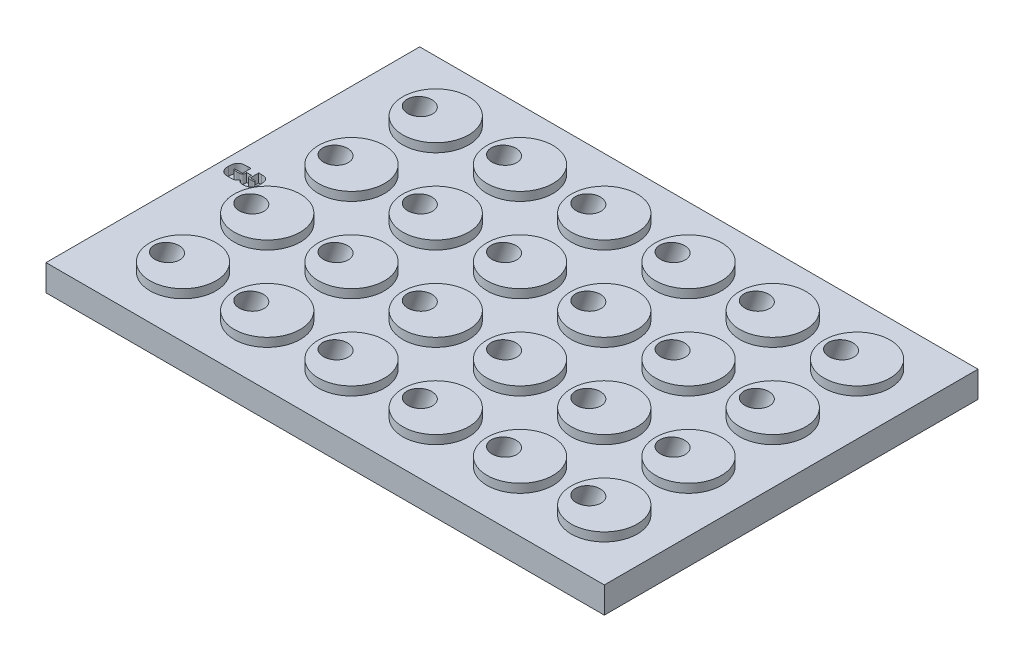
from build123d import *

# Parameters (mm, degrees)
SKETCH1_W           = 127.89
SKETCH1_H           = 85.6
MAIN_PLATE_DEPTH    = 6
WELLS_LSP_R         = 7.56
BOSS_EXTRUDE1_DEPTH = 2
LPATTERN1_START     = -19.125363412
LPATTERN1_OUTLINE_R = 2.75
LPATTERN1_DEPTH     = 43.520202499
CUT_EXTRUDE1_DEPTH  = 2


# Read off the part's stored shape, not the designer's step: LPattern1
with BuildPart() as part:
    # Sketch1 → Main Plate (new body)
    with BuildSketch(Plane(origin=(0, 0, 0), x_dir=(1, 0, 0), z_dir=(0, 1, 0))):
        Rectangle(SKETCH1_W, SKETCH1_H)
    extrude(amount=MAIN_PLATE_DEPTH)

    # Wells_LSP → Boss-Extrude1 (add)
    with BuildSketch(Plane(origin=(0, 6, 0), x_dir=(1, 0, 0), z_dir=(0, 1, 0))):
        with Locations(Location((-46.425, 28.96, 0), (0, 0, 270))):
            Circle(WELLS_LSP_R)
        with Locations(Location((-27.125, 28.96, 0), (0, 0, 270))):
            Circle(WELLS_LSP_R)
        with Locations(Location((-7.825, 28.96, 0), (0, 0, 270))):
            Circle(WELLS_LSP_R)
        with Locations(Location((11.475, 28.96, 0), (0, 0, 270))):
            Circle(WELLS_LSP_R)
        with Locations(Location((30.775, 28.96, 0), (0, 0, 270))):
            Circle(WELLS_LSP_R)
        with Locations(Location((50.075, 28.96, 0), (0, 0, 270))):
            Circle(WELLS_LSP_R)
        with Locations(Location((-27.125, 9.66, 0), (0, 0, 270))):
            Circle(WELLS_LSP_R)
        with Locations(Location((-7.825, 9.66, 0), (0, 0, 270))):
            Circle(WELLS_LSP_R)
        with Locations(Location((11.475, 9.66, 0), (0, 0, 270))):
            Circle(WELLS_LSP_R)
        with Locations(Location((30.775, 9.66, 0), (0, 0, 270))):
            Circle(WELLS_LSP_R)
        with Locations(Location((50.075, 9.66, 0), (0, 0, 270))):
            Circle(WELLS_LSP_R)
        with Locations(Location((-27.125, -9.64, 0), (0, 0, 270))):
            Circle(WELLS_LSP_R)
        with Locations(Location((-7.825, -9.64, 0), (0, 0, 270))):
            Circle(WELLS_LSP_R)
        with Locations(Location((11.475, -9.64, 0), (0, 0, 270))):
            Circle(WELLS_LSP_R)
        with Locations(Location((30.775, -9.64, 0), (0, 0, 270))):
            Circle(WELLS_LSP_R)
        with Locations(Location((50.075, -9.64, 0), (0, 0, 270))):
            Circle(WELLS_LSP_R)
        with Locations(Location((-27.125, -28.94, 0), (0, 0, 270))):
            Circle(WELLS_LSP_R)
        with Locations(Location((-7.825, -28.94, 0), (0, 0, 270))):
            Circle(WELLS_LSP_R)
        with Locations(Location((11.475, -28.94, 0), (0, 0, 270))):
            Circle(WELLS_LSP_R)
        with Locations(Location((30.775, -28.94, 0), (0, 0, 270))):
            Circle(WELLS_LSP_R)
        with Locations(Location((50.075, -28.94, 0), (0, 0, 270))):
            Circle(WELLS_LSP_R)
        with Locations(Location((-46.425, 9.66, 0), (0, 0, 270))):
            Circle(WELLS_LSP_R)
        with Locations(Location((-46.425, -9.64, 0), (0, 0, 270))):
            Circle(WELLS_LSP_R)
        with Locations(Location((-46.425, -28.94, 0), (0, 0, 270))):
            Circle(WELLS_LSP_R)
    extrude(amount=BOSS_EXTRUDE1_DEPTH)

    # Sketch2 → Cut-Revolve1 (revolve, cut)
    with BuildSketch(Plane(origin=(0, 0, -28.96), x_dir=(-1, 0, 0), z_dir=(0, 0, -1)), mode=Mode.PRIVATE) as cut_revolve1_sk:
        Polygon((44.781366193, 22.559444606), (47.3655209, 23.5), (55.918821406, 0), (53.334666698, -0.940555394), align=None)
    revolve(cut_revolve1_sk.sketch.rotate(Axis((-44.781366193, 22.559444606, -28.96), (-0.3420201433256695, -0.9396926207859082, 0)), 180), axis=Axis((-44.781366193, 22.559444606, -28.96), (-0.3420201433256695, -0.9396926207859082, 0)), mode=Mode.SUBTRACT)

    # LPattern1 outline → LPattern1 (cut)
    with BuildSketch(Plane(origin=(0, 0, 0), x_dir=(0.9396926207859079, -0.34202014332566993, 0), z_dir=(0.34202014332567, 0.939692620785908, 0)).offset(LPATTERN1_START)):
        with Locations((-31.660436257, 28.96)):
            Circle(LPATTERN1_OUTLINE_R)
        with Locations((-13.524368676, 28.96)):
            Circle(LPATTERN1_OUTLINE_R)
        with Locations((4.611698906, 28.96)):
            Circle(LPATTERN1_OUTLINE_R)
        with Locations((22.747766487, 28.96)):
            Circle(LPATTERN1_OUTLINE_R)
        with Locations((40.883834068, 28.96)):
            Circle(LPATTERN1_OUTLINE_R)
        with Locations((-49.796503838, 9.66)):
            Circle(LPATTERN1_OUTLINE_R)
        with Locations((-31.660436257, 9.66)):
            Circle(LPATTERN1_OUTLINE_R)
        with Locations((-13.524368676, 9.66)):
            Circle(LPATTERN1_OUTLINE_R)
        with Locations((4.611698906, 9.66)):
            Circle(LPATTERN1_OUTLINE_R)
        with Locations((22.747766487, 9.66)):
            Circle(LPATTERN1_OUTLINE_R)
        with Locations((40.883834068, 9.66)):
            Circle(LPATTERN1_OUTLINE_R)
        with Locations((-49.796503838, -9.64)):
            Circle(LPATTERN1_OUTLINE_R)
        with Locations((-31.660436257, -9.64)):
            Circle(LPATTERN1_OUTLINE_R)
        with Locations((-13.524368676, -9.64)):
            Circle(LPATTERN1_OUTLINE_R)
        with Locations((4.611698906, -9.64)):
            Circle(LPATTERN1_OUTLINE_R)
        with Locations((22.747766487, -9.64)):
            Circle(LPATTERN1_OUTLINE_R)
        with Locations((40.883834068, -9.64)):
            Circle(LPATTERN1_OUTLINE_R)
        with Locations((-49.796503838, -28.94)):
            Circle(LPATTERN1_OUTLINE_R)
        with Locations((-31.660436257, -28.94)):
            Circle(LPATTERN1_OUTLINE_R)
        with Locations((-13.524368676, -28.94)):
            Circle(LPATTERN1_OUTLINE_R)
        with Locations((4.611698906, -28.94)):
            Circle(LPATTERN1_OUTLINE_R)
        with Locations((22.747766487, -28.94)):
            Circle(LPATTERN1_OUTLINE_R)
        with Locations((40.883834068, -28.94)):
            Circle(LPATTERN1_OUTLINE_R)
    extrude(amount=LPATTERN1_DEPTH, mode=Mode.SUBTRACT)

    # Sketch3 → Cut-Extrude1 (cut)
    with BuildSketch(Plane(origin=(0, 6, 0), x_dir=(1, 0, 0), z_dir=(0, 1, 0))):
        with BuildLine():
            add(Edge.make_bspline(
                [(-58.122258832, -4.102834302), (-58.140391436, -4.160972271), (-58.176105501, -4.275481094), (-58.26803878, -4.430861001), (-58.387557684, -4.565760961), (-58.508900564, -4.664784335), (-58.630694365, -4.728150883), (-58.746597581, -4.771454324), (-58.886825305, -4.805317995), (-59.050357082, -4.834405029), (-59.23764482, -4.856549617), (-59.448486266, -4.873065666), (-59.683548017, -4.881057935), (-59.848090402, -4.882803452), (-59.934577146, -4.88372093)],
                knots=[0, 0, 0, 0, 1.016772502, 2.00264, 2.993322914, 4.024041134, 4.601779415, 5.284513473, 6.090012932, 7.012903525, 8.063870125, 9.245484246, 10.552171844, 12, 12, 12, 12], degree=3))
            add(Edge.make_bspline(
                [(-59.934577146, -4.88372093), (-59.999874152, -4.883362561), (-60.126718514, -4.882666401), (-60.31168497, -4.87356146), (-60.485686156, -4.85874754), (-60.648987687, -4.836928912), (-60.801711646, -4.810188821), (-60.944481808, -4.779607974), (-61.075417297, -4.739614127), (-61.196790948, -4.694959633), (-61.309944933, -4.643234102), (-61.414654069, -4.579569657), (-61.51457145, -4.508691241), (-61.607626946, -4.426644089), (-61.694189965, -4.33521229), (-61.772972495, -4.23347996), (-61.847405325, -4.123971684), (-61.914393147, -4.00435865), (-61.974681603, -3.875818995), (-62.024400915, -3.737782073), (-62.070018712, -3.592654818), (-62.104725635, -3.438106385), (-62.13321013, -3.275618271), (-62.15100934, -3.104751355), (-62.165024753, -2.926222906), (-62.166060386, -2.804354881), (-62.166590228, -2.742005814)],
                knots=[0, 0, 0, 0, 1.306481367, 2.53793869, 3.70454975, 4.799899347, 5.83332077, 6.806790108, 7.719247424, 8.570123773, 9.393667299, 10.203998039, 11.018536018, 11.842079543, 12.682189451, 13.534080057, 14.414017936, 15.329427877, 16.27442779, 17.251402079, 18.26300703, 19.316565067, 20.418301405, 21.562113702, 22.752749651, 24, 24, 24, 24], degree=3))
            add(Edge.make_bspline(
                [(-62.166590228, -2.742005814), (-62.165404924, -2.674588433), (-62.163099281, -2.543448732), (-62.151278192, -2.352254117), (-62.127471672, -2.172465591), (-62.098217265, -2.002584656), (-62.057060121, -1.844381808), (-62.009399091, -1.69626143), (-61.950099258, -1.560346663), (-61.884880561, -1.433784645), (-61.809933311, -1.320300288), (-61.7342744, -1.214520279), (-61.651938062, -1.120676116), (-61.568014131, -1.034804757), (-61.477252138, -0.961713213), (-61.383639298, -0.89835106), (-61.286082203, -0.84392919), (-61.181597217, -0.799761157), (-61.065979111, -0.764124481), (-60.934939534, -0.734131583), (-60.786123697, -0.706989799), (-60.618625347, -0.688097575), (-60.433747585, -0.671556889), (-60.231078405, -0.658340277), (-60.010066692, -0.652978804), (-59.856574296, -0.651783467), (-59.776873658, -0.651162791)],
                knots=[0, 0, 0, 0, 1.29986345, 2.528483056, 3.690179472, 4.794698139, 5.849224155, 6.839060682, 7.790920779, 8.704834231, 9.579881091, 10.41028086, 11.209865728, 11.984243757, 12.722004226, 13.451891505, 14.161549165, 14.871959378, 15.634473006, 16.490848817, 17.462329798, 18.549016499, 19.73880478, 21.040824574, 22.463453722, 24, 24, 24, 24], degree=3))
            Line((-59.776873658, -0.651162791), (-59.154962321, -0.651162791))
            Line((-59.154962321, -0.651162791), (-59.154962321, -2.604651163))
            Line((-59.154962321, -2.604651163), (-60.344097495, -2.604651163))
            add(Edge.make_bspline(
                [(-60.344097495, -2.604651163), (-60.379287069, -2.604398856), (-60.445861937, -2.603921518), (-60.539538181, -2.607063491), (-60.621770559, -2.609769418), (-60.692662286, -2.611402962), (-60.752501162, -2.616471685), (-60.800745234, -2.623152505), (-60.837989188, -2.628543584), (-60.87074786, -2.638200344), (-60.898895575, -2.652347427), (-60.924723622, -2.668619633), (-60.94181248, -2.687647006), (-60.944471531, -2.702362056), (-60.945659995, -2.708938953)],
                knots=[0, 0, 0, 0, 1.98952573, 3.763967478, 5.298808493, 6.641994911, 7.772666489, 8.691384785, 9.396776596, 9.897288848, 10.615595082, 11.167430286, 11.62788259, 12, 12, 12, 12], degree=3))
            add(Edge.make_bspline(
                [(-60.945659995, -2.708938953), (-60.944217952, -2.728620253), (-60.941453407, -2.766351332), (-60.919547745, -2.81886366), (-60.879189917, -2.858480968), (-60.834859895, -2.884104707), (-60.785287141, -2.896122517), (-60.732394578, -2.906522915), (-60.662976714, -2.913155994), (-60.578188407, -2.919525296), (-60.477669325, -2.9242861), (-60.361936961, -2.928481221), (-60.230479417, -2.928825517), (-60.137640139, -2.929745345), (-60.088465228, -2.930232558)],
                knots=[0, 0, 0, 0, 0.731326549, 1.402028383, 2.059821905, 2.800938167, 3.275195982, 3.949224547, 4.805765994, 5.86494895, 7.111968563, 8.547350483, 10.171207919, 12, 12, 12, 12], degree=3))
            Line((-60.088465228, -2.930232558), (-59.619170169, -2.930232558))
            add(Edge.make_bspline(
                [(-59.619170169, -2.930232558), (-59.561921657, -2.92914035), (-59.456165609, -2.927122698), (-59.310503295, -2.915814377), (-59.191242355, -2.893952638), (-59.096019778, -2.862461226), (-59.021116543, -2.820078383), (-58.962011533, -2.768895794), (-58.915841211, -2.709050859), (-58.889513571, -2.650371313), (-58.875190563, -2.594349219), (-58.863341649, -2.539789532), (-58.855294445, -2.472075988), (-58.848162597, -2.392295098), (-58.839634014, -2.300398082), (-58.835858614, -2.19597023), (-58.829687613, -2.079032227), (-58.828652935, -1.996739992), (-58.828109123, -1.953488372)],
                knots=[0, 0, 0, 0, 1.792998066, 3.312232631, 4.569779943, 5.581606765, 6.43785988, 7.247129714, 8.014480138, 8.786866925, 9.240963713, 9.824186057, 10.533905351, 11.374055212, 12.333214531, 13.423111507, 14.645624337, 16, 16, 16, 16], degree=3))
            Line((-58.828109123, -1.953488372), (-57.689846042, -1.953488372))
            add(Edge.make_bspline(
                [(-57.689846042, -1.953488372), (-57.69013631, -2.004787779), (-57.690685707, -2.101882937), (-57.68704918, -2.239212019), (-57.685829587, -2.360107252), (-57.679895494, -2.463919486), (-57.675448165, -2.550898554), (-57.669283061, -2.620934205), (-57.6621678, -2.674507888), (-57.651470315, -2.72351085), (-57.628087086, -2.769887181), (-57.590293307, -2.815639924), (-57.540431053, -2.852829255), (-57.477747672, -2.883378276), (-57.396538204, -2.903838711), (-57.295340289, -2.920152044), (-57.170626128, -2.927692357), (-57.080230983, -2.929337523), (-57.031052437, -2.930232558)],
                knots=[0, 0, 0, 0, 1.682593821, 3.184670591, 4.506008046, 5.64763409, 6.594858561, 7.362827826, 7.952798157, 8.367646082, 9.001997565, 9.634058688, 10.298776048, 11.026406123, 11.906980625, 13.034031577, 14.386395493, 16, 16, 16, 16], degree=3))
            Line((-57.031052437, -2.930232558), (-56.649511739, -2.930232558))
            add(Edge.make_bspline(
                [(-56.649511739, -2.930232558), (-56.598646742, -2.929335831), (-56.507417067, -2.927727492), (-56.385927105, -2.920770558), (-56.29592882, -2.904976021), (-56.231894965, -2.884685914), (-56.190435488, -2.853303698), (-56.163960098, -2.817124199), (-56.145246328, -2.775465984), (-56.143992954, -2.745193408), (-56.143334414, -2.729287791)],
                knots=[0, 0, 0, 0, 2.009986585, 3.605041449, 4.797209238, 5.618380569, 6.227895259, 6.813958231, 7.376837767, 8, 8, 8, 8], degree=3))
            add(Edge.make_bspline(
                [(-56.143334414, -2.729287791), (-56.144557312, -2.72232607), (-56.147323154, -2.706580679), (-56.164438488, -2.684376333), (-56.192260844, -2.665280265), (-56.22154079, -2.647922661), (-56.25398499, -2.634412013), (-56.289986359, -2.628439738), (-56.33512075, -2.620004397), (-56.390363606, -2.61394448), (-56.456194727, -2.611026366), (-56.531600479, -2.606278578), (-56.617300086, -2.606098529), (-56.677494148, -2.605151401), (-56.709286449, -2.604651163)],
                knots=[0, 0, 0, 0, 0.413086695, 0.93428225, 1.595543607, 2.403287019, 2.942817202, 3.660055847, 4.549491017, 5.658654472, 6.938262655, 8.442963608, 10.121303532, 12, 12, 12, 12], degree=3))
            Line((-56.709286449, -2.604651163), (-57.364264646, -2.604651163))
            Line((-57.364264646, -2.604651163), (-57.364264646, -0.651162791))
            Line((-57.364264646, -0.651162791), (-56.692753018, -0.651162791))
            add(Edge.make_bspline(
                [(-56.692753018, -0.651162791), (-56.610041344, -0.652627441), (-56.451521083, -0.655434502), (-56.223933779, -0.67659971), (-56.017229928, -0.713343053), (-55.83042056, -0.762920598), (-55.664885021, -0.829462886), (-55.519032948, -0.909357216), (-55.394190788, -1.005518116), (-55.289085618, -1.117106732), (-55.202101955, -1.244683385), (-55.126877808, -1.386833157), (-55.063547336, -1.54555559), (-55.011695478, -1.72058228), (-54.971481853, -1.912010058), (-54.94234849, -2.11932987), (-54.926426547, -2.34325874), (-54.923777869, -2.497795652), (-54.922404181, -2.577943314)],
                knots=[0, 0, 0, 0, 1.298827903, 2.489256105, 3.584916422, 4.592731659, 5.518699449, 6.380016995, 7.196315096, 7.982831078, 8.776946154, 9.613834542, 10.503950702, 11.45599722, 12.477094451, 13.57301768, 14.741291287, 16, 16, 16, 16], degree=3))
            add(Edge.make_bspline(
                [(-54.922404181, -2.577943314), (-54.923482723, -2.681869928), (-54.925550985, -2.881164557), (-54.951792398, -3.167029349), (-54.99149775, -3.42683214), (-55.046269897, -3.661568195), (-55.119847235, -3.87030713), (-55.209877005, -4.053415775), (-55.315366762, -4.211569568), (-55.440222228, -4.341817016), (-55.578480327, -4.449643103), (-55.725264577, -4.54436583), (-55.882558614, -4.625343449), (-56.05134349, -4.689545923), (-56.229915603, -4.740960119), (-56.419488341, -4.775857756), (-56.619313941, -4.797933436), (-56.756283068, -4.800839964), (-56.826292263, -4.802325581)],
                knots=[0, 0, 0, 0, 1.476008535, 2.830464308, 4.074122937, 5.207690784, 6.249690768, 7.211253244, 8.099946175, 8.939181304, 9.762202967, 10.585819403, 11.418132127, 12.270405365, 13.147326465, 14.054500677, 15.005594585, 16, 16, 16, 16], degree=3))
            add(Edge.make_bspline(
                [(-56.826292263, -4.802325581), (-56.873362163, -4.801887388), (-56.964176482, -4.801041959), (-57.095278469, -4.793204278), (-57.216859265, -4.781296796), (-57.328712573, -4.761521129), (-57.431739871, -4.739408551), (-57.525627188, -4.711719968), (-57.609174923, -4.677275721), (-57.708980251, -4.626338592), (-57.820944178, -4.544093466), (-57.936131179, -4.419219003), (-58.042081579, -4.273126806), (-58.094823421, -4.161105754), (-58.122258832, -4.102834302)],
                knots=[0, 0, 0, 0, 1.069228013, 2.062915217, 2.982926813, 3.842689865, 4.641840846, 5.37614676, 6.062934199, 6.6918398, 7.918967149, 9.192935562, 10.539812704, 12, 12, 12, 12], degree=3))
        make_face()
    extrude(amount=-CUT_EXTRUDE1_DEPTH, mode=Mode.SUBTRACT)


solid = part.part
